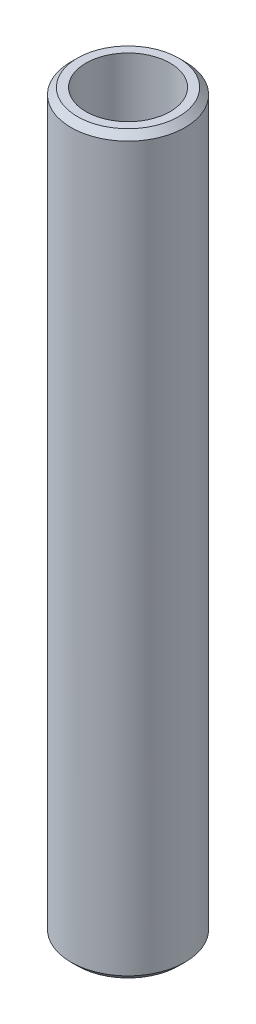
from build123d import *

# Parameters (mm, degrees)
SKETCH1_R           = 32.5
BOSS_EXTRUDE1_DEPTH = 419.31278252
SKETCH2_R           = 24.005377921
CUT_EXTRUDE1_DEPTH  = 422.824263864
CHAMFER1_SIZE       = 3.60149748


with BuildPart() as part:
    # Sketch1 → Boss-Extrude1 (new body)
    with BuildSketch(Plane(origin=(0, 0, 0), x_dir=(1, 0, 0), z_dir=(0, 1, 0))):
        Circle(SKETCH1_R)
    extrude(amount=BOSS_EXTRUDE1_DEPTH)

    # Sketch2 → Cut-Extrude1 (cut, through all)
    with BuildSketch(Plane(origin=(0, 0, 0), x_dir=(1, 0, 0), z_dir=(0, 1, 0))):
        Circle(SKETCH2_R)
    extrude(amount=CUT_EXTRUDE1_DEPTH, mode=Mode.SUBTRACT)

    # Chamfer1
    chamfer1_edges = [part.edges().sort_by_distance(p)[0] for p in [
        (-32.5, 419.31278252, 0),
        (-32.5, 0, 0),
    ]]
    chamfer(chamfer1_edges, length=CHAMFER1_SIZE)


solid = part.part
